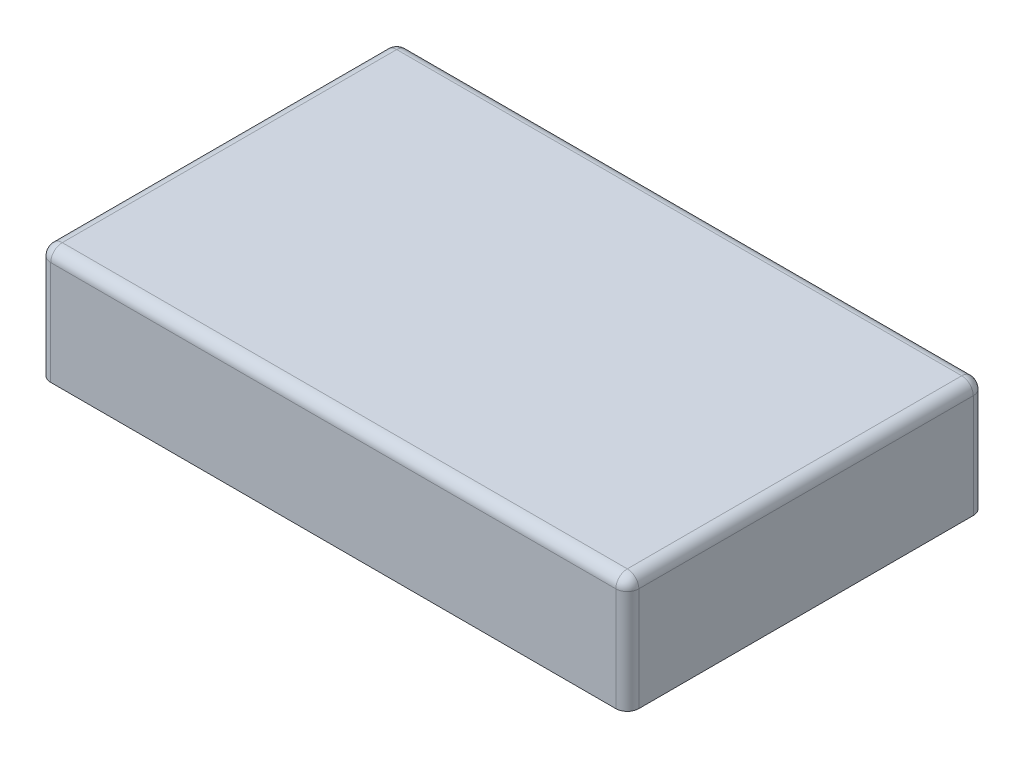
from build123d import *

# Parameters (mm, degrees)
BOSS_EXTRUDE1_DEPTH = 20
FILLET1_R           = 2
SHELL1_START        = -49
SHELL1_OUTLINE_W    = 18
SHELL1_OUTLINE_H    = 58
SHELL1_DEPTH        = 98
FILLET2_R           = 1


# Read off the part's stored shape, not the designer's step: Shell1
with BuildPart() as part:
    # Sketch1 → Boss-Extrude1 (new body)
    with BuildSketch(Plane(origin=(0, 0, 0), x_dir=(1, 0, 0), z_dir=(0, 1, 0))):
        with BuildLine():
            Line((-49, -31), (49, -31))
            ThreePointArc((49, -31), (50.414213562, -30.414213562), (51, -29))
            Line((51, -29), (51, 29))
            ThreePointArc((51, 29), (50.414213562, 30.414213562), (49, 31))
            Line((49, 31), (-49, 31))
            ThreePointArc((-49, 31), (-50.414213562, 30.414213562), (-51, 29))
            Line((-51, 29), (-51, -29))
            ThreePointArc((-51, -29), (-50.414213562, -30.414213562), (-49, -31))
        make_face()
    extrude(amount=BOSS_EXTRUDE1_DEPTH)

    # Fillet1
    fillet1_edges = [part.edges().sort_by_distance(p)[0] for p in [
        (50.414213562, 20, -30.414213562),
        (0, 20, -31),
        (-50.414213562, 20, -30.414213562),
        (-51, 20, 0),
        (-50.414213562, 20, 30.414213562),
        (0, 20, 31),
        (50.414213562, 20, 30.414213562),
        (51, 20, 0),
    ]]
    fillet(fillet1_edges, radius=FILLET1_R)

    # Shell1 outline → Shell1 (cut)
    with BuildSketch(Plane.YZ.offset(SHELL1_START)):
        with Locations((9, 0)):
            Rectangle(SHELL1_OUTLINE_W, SHELL1_OUTLINE_H)
    extrude(amount=SHELL1_DEPTH, mode=Mode.SUBTRACT)

    # Fillet2
    fillet2_edges = [part.edges().sort_by_distance(p)[0] for p in [
        (49, 9, 29),
        (49, 0, 0),
        (0, 18, -29),
        (49, 9, -29),
        (0, 0, -29),
        (-49, 18, 0),
        (-49, 9, -29),
        (-49, 0, 0),
        (0, 18, 29),
        (-49, 9, 29),
        (0, 0, 29),
        (49, 18, 0),
    ]]
    fillet(fillet2_edges, radius=FILLET2_R)


solid = part.part
